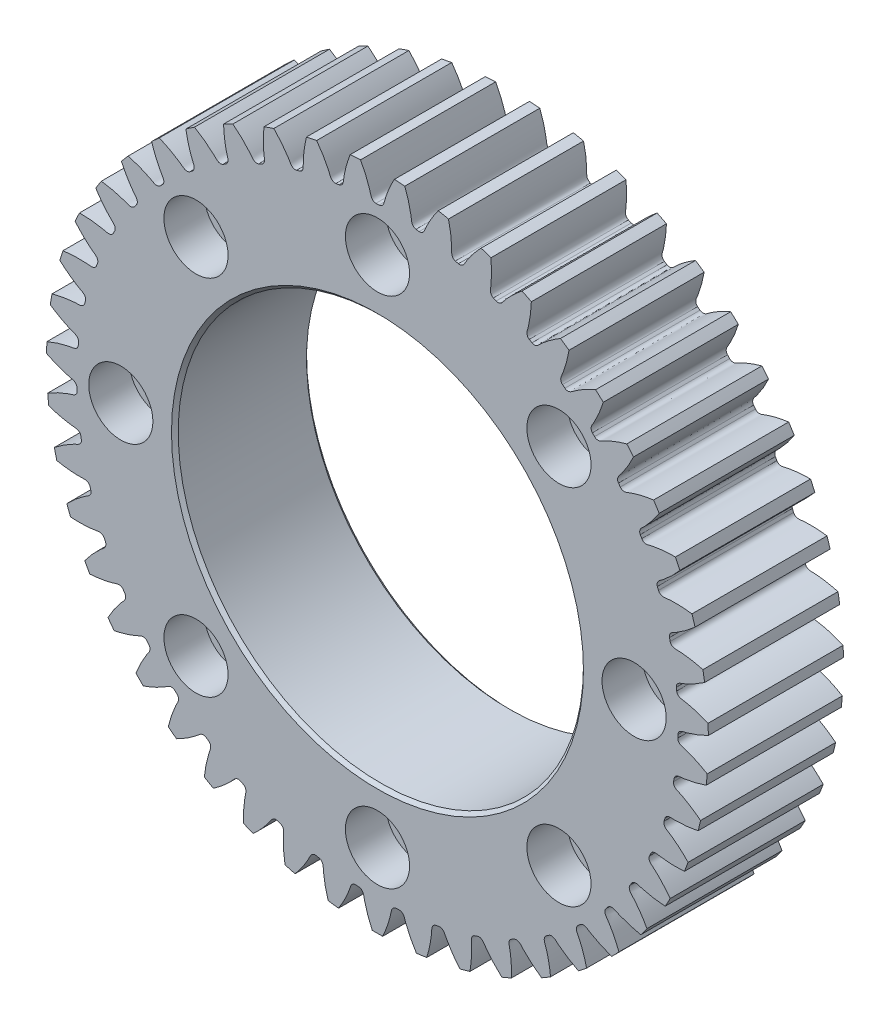
from build123d import *

# Parameters (mm, degrees)
GEAR_BASESKETCH_R                            = 49
F_2_0_94_0000MM_P_D_DEPTH                    = 10
TOOTH_CUT_START                              = -10
TOOTH_CUT_COARSE_PITCH_INVOLUTE_20_DEG_DEPTH = 20
PATTERN_CIRCULAR_1_COUNT                     = 47
SKETCH_3_R                                   = 30
CUT_EXTRUDE_2_DEPTH                          = 46.5
SKETCH_4_R                                   = 3
CUT_EXTRUDE_3_DEPTH                          = 40
SKETCH_5_R                                   = 4.75
CUT_EXTRUDE_4_DEPTH                          = 6
CHAMFER_1_SIZE                               = 0.5


# Read off the part's stored shape, not the designer's step: Tooth-Cut, Coarse Pitch Involute 20 deg
with BuildPart() as part:
    # Gear-BaseSketch → 2.0 模数    , 94.0000mm P.D. (new, symmetric)
    with BuildSketch(Plane.XY):
        Circle(GEAR_BASESKETCH_R)
    extrude(amount=F_2_0_94_0000MM_P_D_DEPTH, both=True)

    # Tooth-Cut_ Coarse Pitch Involute 20  2 → Tooth-Cut, Coarse Pitch Involute 20 deg (cut)
    with BuildSketch(Plane.XY.offset(TOOTH_CUT_START)):
        with BuildLine():
            ThreePointArc((2.502990216, 48.93603008), (0, 49), (-2.502990216, 48.93603008))
            add(Edge.make_bspline(
                [(-2.502990216, 48.93603008), (-2.455800136, 48.849220434), (-2.34648286, 48.646909872), (-2.184115392, 48.330615339), (-2.018214362, 47.992461407), (-1.866160245, 47.666313195), (-1.727272449, 47.352651394), (-1.601039983, 47.051840984), (-1.486896454, 46.76425525), (-1.384279413, 46.490243851), (-1.292607072, 46.230142826), (-1.211315629, 45.984263822), (-1.139745478, 45.752923721), (-1.0775242, 45.536345326), (-1.030372678, 45.361293003), (-1.00101639, 45.241087754), (-0.98172277, 45.172128756), (-0.966050133, 45.122290612), (-0.94301534, 45.056621874), (-0.909017202, 44.974460868), (-0.856824635, 44.875011254), (-0.78584724, 44.771433885), (-0.683516838, 44.663233641), (-0.533413833, 44.561055604), (-0.371097552, 44.507134463), (-0.263246234, 44.501319748), (-0.227939532, 44.499416216)],
                knots=[0.021598725, 0.021598725, 0.021598725, 0.021598725, 0.077832197, 0.15247489, 0.223928078, 0.292191761, 0.357265939, 0.419150613, 0.477845782, 0.533351446, 0.585667605, 0.634794259, 0.680731409, 0.723479054, 0.763037195, 0.783902694, 0.793896204, 0.803785861, 0.813631238, 0.833497985, 0.854334723, 0.877443406, 0.904759056, 0.938604789, 0.979901383, 1, 1, 1, 1], degree=3))
            ThreePointArc((-0.227939532, 44.499416216), (0, 44.5), (0.227939532, 44.499416216))
            add(Edge.make_bspline(
                [(0.227939532, 44.499416216), (0.263246234, 44.501319748), (0.371097552, 44.507134463), (0.533413833, 44.561055604), (0.683516838, 44.663233641), (0.78584724, 44.771433885), (0.856824635, 44.875011254), (0.909017202, 44.974460868), (0.94301534, 45.056621874), (0.966050133, 45.122290612), (0.98172277, 45.172128756), (1.00101639, 45.241087754), (1.030372678, 45.361293003), (1.0775242, 45.536345326), (1.139745478, 45.752923721), (1.211315629, 45.984263822), (1.292607072, 46.230142826), (1.384279413, 46.490243851), (1.486896454, 46.76425525), (1.601039983, 47.051840984), (1.727272449, 47.352651394), (1.866160245, 47.666313195), (2.018214362, 47.992461407), (2.184115392, 48.330615339), (2.34648286, 48.646909872), (2.455800136, 48.849220434), (2.502990216, 48.93603008)],
                knots=[0, 0, 0, 0, 0.020098617, 0.061395211, 0.095240944, 0.122556594, 0.145665277, 0.166502015, 0.186368762, 0.196214139, 0.206103796, 0.216097306, 0.236962805, 0.276520946, 0.319268591, 0.365205741, 0.414332395, 0.466648554, 0.522154218, 0.580849387, 0.642734061, 0.707808239, 0.776071922, 0.84752511, 0.922167803, 0.978401275, 0.978401275, 0.978401275, 0.978401275], degree=3))
        make_face()
    tooth_cut_coarse_pitch_involute_20_deg = extrude(amount=TOOTH_CUT_COARSE_PITCH_INVOLUTE_20_DEG_DEPTH, mode=Mode.SUBTRACT)

    # 阵列(圆周)1: Tooth-Cut, Coarse Pitch Involute 20 deg ×47 about axis
    pattern_circular_1_axis = Axis((0, 0, -88.99), (0, 0, 1))
    for i in range(1, PATTERN_CIRCULAR_1_COUNT):
        add(tooth_cut_coarse_pitch_involute_20_deg.rotate(pattern_circular_1_axis, i * 360 / PATTERN_CIRCULAR_1_COUNT), mode=Mode.SUBTRACT)

    # 草图3 → 切除-拉伸2 (cut)
    with BuildSketch(Plane.XY.offset(10)):
        Circle(SKETCH_3_R)
    extrude(amount=-CUT_EXTRUDE_2_DEPTH, mode=Mode.SUBTRACT)

    # 草图4 → 切除-拉伸3 (cut)
    with BuildSketch(Plane.XY.offset(10)):
        with Locations((26.870057685, 26.870057685)):
            Circle(SKETCH_4_R)
        with Locations((0, 38)):
            Circle(SKETCH_4_R)
        with Locations((38, 0)):
            Circle(SKETCH_4_R)
        with Locations((26.870057685, -26.870057685)):
            Circle(SKETCH_4_R)
        with Locations((0, -38)):
            Circle(SKETCH_4_R)
        with Locations((-26.870057685, -26.870057685)):
            Circle(SKETCH_4_R)
        with Locations((-38, 0)):
            Circle(SKETCH_4_R)
        with Locations((-26.870057685, 26.870057685)):
            Circle(SKETCH_4_R)
    extrude(amount=-CUT_EXTRUDE_3_DEPTH, mode=Mode.SUBTRACT)

    # 草图5 → 切除-拉伸4 (cut)
    with BuildSketch(Plane.XY.offset(10)):
        with Locations((0, 38)):
            Circle(SKETCH_5_R)
        with Locations((26.870057685, 26.870057685)):
            Circle(SKETCH_5_R)
        with Locations((38, 0)):
            Circle(SKETCH_5_R)
        with Locations((26.870057685, -26.870057685)):
            Circle(SKETCH_5_R)
        with Locations((0, -38)):
            Circle(SKETCH_5_R)
        with Locations((-26.870057685, -26.870057685)):
            Circle(SKETCH_5_R)
        with Locations((-38, 0)):
            Circle(SKETCH_5_R)
        with Locations((-26.870057685, 26.870057685)):
            Circle(SKETCH_5_R)
    extrude(amount=-CUT_EXTRUDE_4_DEPTH, mode=Mode.SUBTRACT)

    # 倒角1
    chamfer_1_edges = [part.edges().sort_by_distance(p)[0] for p in [
        (-30, 0, -10),
        (-30, 0, 10),
    ]]
    chamfer(chamfer_1_edges, length=CHAMFER_1_SIZE)


solid = part.part
